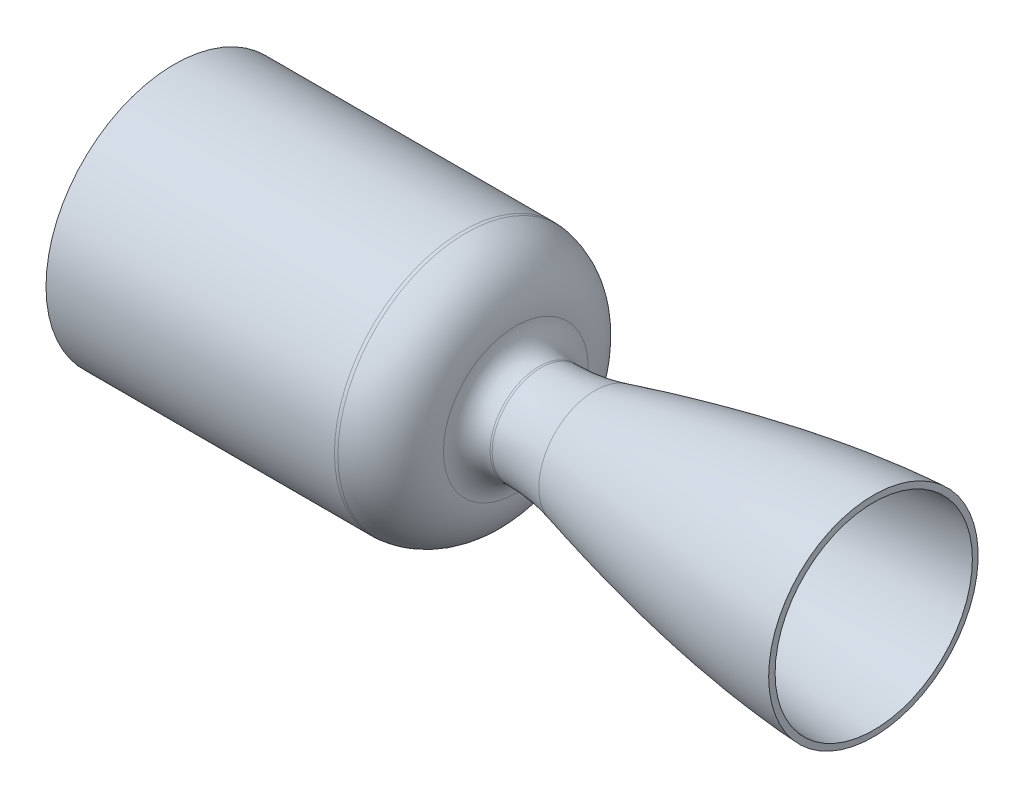
from build123d import *

# Parameters (mm, degrees)
FILLET2_R = 10


# Read off the part's stored shape, not the designer's step: Revolve-Thin1
with BuildPart() as part:
    # Revolve-Thin1 outline → Revolve-Thin1 (revolve)
    with BuildSketch(Plane.YX):
        with BuildLine():
            ThreePointArc((20.809194043, 175.40901311), (18.540551824, 164.003778488), (17.78, 152.4))
            ThreePointArc((17.78, 152.4), (18.931985096, 144.91543265), (22.281305618, 138.123682499))
            ThreePointArc((22.281305618, 138.123682499), (40.863057404, 136.154543576), (50.8, 120.33))
            Line((50.8, 120.33), (50.8, 0))
            Line((50.8, 0), (53.34, 0))
            Line((53.34, 0), (53.34, 120.464002572))
            ThreePointArc((53.34, 120.464002572), (43.123071275, 137.708761877), (23.372253336, 141.125272789))
            ThreePointArc((23.372253336, 141.125272789), (21.096554077, 146.559714816), (20.32, 152.4))
            ThreePointArc((20.32, 152.4), (21.058821772, 163.67224196), (23.262645642, 174.751612735))
            add(Edge.make_bspline(
                [(23.262645642, 174.751612735), (35.023141074, 218.642379212), (41.79057094, 257.222392684), (43.53651902, 290.537066698)],
                knots=[0, 0, 0, 0, 1, 1, 1, 1], degree=3))
            Line((43.53651902, 290.537066698), (41.000000001, 290.670000027))
            add(Edge.make_bspline(
                [(41.000000001, 290.670000027), (38.399983722, 241.058733938), (20.809194043, 175.40901311)],
                knots=[0.495939659, 0.495939659, 0.495939659, 0.498282386, 0.498282386, 0.498282386], degree=2))
        make_face()
    revolve(axis=Axis((0, 0, 0), (1, 0, 0)))

    # Fillet2
    fillet2_edges = [part.edges().sort_by_distance(p)[0] for p in [
        (138.123682499, -22.281305618, 0),
        (120.33, -50.8, 0),
        (120.464002572, -53.34, 0),
        (141.125272789, -23.372253336, 0),
    ]]
    fillet(fillet2_edges, radius=FILLET2_R)


solid = part.part
